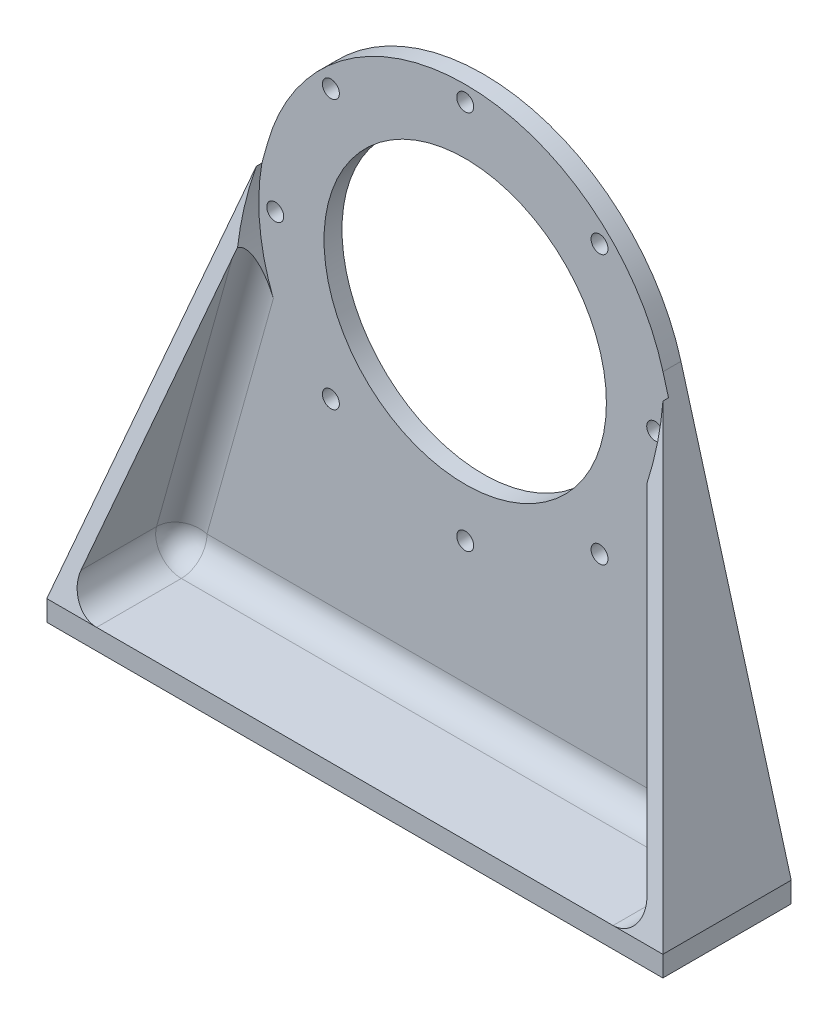
from build123d import *

# Parameters (mm, degrees)
EXTRUDE_3_DEPTH          = 25
SKETCH_1_5_R             = 1.65
SKETCH_1_5_R_2           = 27.5
EXTRUDE_4_DEPTH          = 3.5
CUT_EXTRUDE_1_DEPTH      = 116
CUT_EXTRUDE_1_DEPTH_BACK = 90
SKETCH_3_R               = 40.2
CUT_EXTRUDE_2_DEPTH      = 90
FILLET_1_R               = 5


with BuildPart() as part:
    # 草图1 → 凸台-拉伸3 (new body)
    with BuildSketch(Plane.XY):
        with BuildLine():
            Line((56.884812739, -66), (60, -66))
            Line((60, -66), (38.520958758, 10.776629174))
            ThreePointArc((38.520958758, 10.776629174), (0, 40), (-38.520958758, 10.776629174))
            Line((-38.520958758, 10.776629174), (-60, -66))
            Line((-60, -66), (-56.884812739, -66))
            Line((-56.884812739, -66), (-38.56602674, -0.519673214))
            ThreePointArc((-38.56602674, -0.519673214), (-38.588989549, 0.444535953), (-38.069024769, 1.256855618))
            Line((-38.069024769, 1.256855618), (-35.631886851, 9.968381986))
            ThreePointArc((-35.631886851, 9.968381986), (-32.349305917, 17.958908839), (-27.303372186, 24.970499941))
            ThreePointArc((-27.303372186, 24.970499941), (-27.329677093, 27.329677093), (-24.970499941, 27.303372186))
            ThreePointArc((-24.970499941, 27.303372186), (-14.159286998, 34.183542703), (-1.649589784, 36.963209459))
            ThreePointArc((-1.649589784, 36.963209459), (-0.018396414, 38.649897443), (1.65, 37))
            ThreePointArc((1.65, 37), (1.649897443, 36.981603586), (1.649589784, 36.963209459))
            ThreePointArc((1.649589784, 36.963209459), (14.159286998, 34.183542703), (24.970499941, 27.303372186))
            ThreePointArc((24.970499941, 27.303372186), (26.77734325, 27.694297385), (27.812950904, 26.162950904))
            ThreePointArc((27.812950904, 26.162950904), (27.680217379, 25.514566417), (27.303372186, 24.970499941))
            ThreePointArc((27.303372186, 24.970499941), (32.349305917, 17.958908839), (35.631886851, 9.968381986))
            Line((35.631886851, 9.968381986), (38.069024769, 1.256855618))
            ThreePointArc((38.069024769, 1.256855618), (38.497730094, 0.692318255), (38.65, 0))
            ThreePointArc((38.65, 0), (38.628871407, -0.263207028), (38.56602674, -0.519673214))
            Line((38.56602674, -0.519673214), (56.884812739, -66))
        make_face()
        Polygon((-60, -70), (-60, -66), (60, -66), (60, -70), (0, -70), align=None)
    extrude(amount=EXTRUDE_3_DEPTH)

    # 草图1<5> → 凸台-拉伸4 (add)
    with BuildSketch(Plane.XY):
        with BuildLine():
            Line((-56.884812739, -66), (56.884812739, -66))
            Line((56.884812739, -66), (38.56602674, -0.519673214))
            ThreePointArc((38.56602674, -0.519673214), (35.411010451, -0.444535953), (38.069024769, 1.256855618))
            Line((38.069024769, 1.256855618), (35.631886851, 9.968381986))
            ThreePointArc((35.631886851, 9.968381986), (32.349305917, 17.958908839), (27.303372186, 24.970499941))
            ThreePointArc((27.303372186, 24.970499941), (24.996224715, 24.996224715), (24.970499941, 27.303372186))
            ThreePointArc((24.970499941, 27.303372186), (14.159286998, 34.183542703), (1.649589784, 36.963209459))
            ThreePointArc((1.649589784, 36.963209459), (0, 35.35), (-1.649589784, 36.963209459))
            ThreePointArc((-1.649589784, 36.963209459), (-14.159286998, 34.183542703), (-24.970499941, 27.303372186))
            ThreePointArc((-24.970499941, 27.303372186), (-24.631604423, 26.77734325), (-24.512950904, 26.162950904))
            ThreePointArc((-24.512950904, 26.162950904), (-25.514566417, 24.645684428), (-27.303372186, 24.970499941))
            ThreePointArc((-27.303372186, 24.970499941), (-32.349305917, 17.958908839), (-35.631886851, 9.968381986))
            Line((-35.631886851, 9.968381986), (-38.069024769, 1.256855618))
            ThreePointArc((-38.069024769, 1.256855618), (-36.307681745, 1.497730094), (-35.35, 0))
            ThreePointArc((-35.35, 0), (-36.736792972, -1.628871407), (-38.56602674, -0.519673214))
            Line((-38.56602674, -0.519673214), (-56.884812739, -66))
        make_face()
        with Locations((0, -37)):
            Circle(SKETCH_1_5_R, mode=Mode.SUBTRACT)
        with Locations((-26.162950904, -26.162950904)):
            Circle(SKETCH_1_5_R, mode=Mode.SUBTRACT)
        with Locations((26.162950904, -26.162950904)):
            Circle(SKETCH_1_5_R, mode=Mode.SUBTRACT)
        Circle(SKETCH_1_5_R_2, mode=Mode.SUBTRACT)
    extrude(amount=EXTRUDE_4_DEPTH)

    # 草图2 → 切除-拉伸1 (cut, two sides: drawn at the far end of the back side and taken through both)
    with BuildSketch(Plane(origin=(0, 0, 0), x_dir=(0, 0, -1), z_dir=(1, 0, 0)).offset(-CUT_EXTRUDE_1_DEPTH_BACK)):
        Polygon((-25, -66), (-3.5, 10.776629174), (-3.5, 62.872025622), (-39.293867153, 54.574713181), (-52.271714816, -41.589010491), align=None)
    extrude(amount=CUT_EXTRUDE_1_DEPTH + CUT_EXTRUDE_1_DEPTH_BACK, mode=Mode.SUBTRACT)

    # 草图3 → 切除-拉伸2 (cut)
    with BuildSketch(Plane.XY.offset(3.5)):
        Circle(SKETCH_3_R)
    extrude(amount=CUT_EXTRUDE_2_DEPTH, mode=Mode.SUBTRACT)

    # 圆角1
    # the kernel refuses this fillet: 5 mm, written as the material it adds along each edge
    with BuildSketch(Plane(origin=(-50.294033224, -61, 8.5), x_dir=(0, -1, 0), z_dir=(0, 0, -1))) as fillet_1_piece_1_section:
        Polygon((0, 0), (FILLET_1_R, 0), (FILLET_1_R, FILLET_1_R * 1.31815590294), (-FILLET_1_R * 0.269415729351, FILLET_1_R * 0.963023968953), align=None)
    fillet_1_piece_1 = extrude(amount=FILLET_1_R, mode=Mode.PRIVATE)
    fillet_1_piece_1 = fillet_1_piece_1 - Plane(origin=(-50.294033224, -61, 8.5), x_dir=(0.7966855494331734, 0.6043940232367977, 0), z_dir=(0, 0, -1)) * Sphere(FILLET_1_R, mode=Mode.PRIVATE)
    add(fillet_1_piece_1)
    with BuildSketch(Plane(origin=(50.294033224, -61, 8.5), x_dir=(0.9630239689530686, 0.26941572935127434, 0), z_dir=(0, 0, -1))) as fillet_1_piece_2_section:
        Polygon((0, 0), (FILLET_1_R, 0), (FILLET_1_R, FILLET_1_R * 1.31815590294), (-FILLET_1_R * 0.269415729351, FILLET_1_R * 0.963023968953), align=None)
    fillet_1_piece_2 = extrude(amount=FILLET_1_R, mode=Mode.PRIVATE)
    fillet_1_piece_2 = fillet_1_piece_2 - Plane(origin=(50.294033224, -61, 8.5), x_dir=(-0.7966855494331732, 0.6043940232367977, 0), z_dir=(0, 0, -1)) * Sphere(FILLET_1_R, mode=Mode.PRIVATE)
    add(fillet_1_piece_2)
    with BuildSketch(Plane(origin=(-56.884812739, -66, 8.5), x_dir=(1, 0, 0), z_dir=(0, 0, 1))) as fillet_1_piece_3_section:
        with BuildLine():
            CenterArc((FILLET_1_R * 1.31815590294, FILLET_1_R), FILLET_1_R, 164.370497689, 105.629502311)
            Line((FILLET_1_R * 0.35513193399, FILLET_1_R * 1.26941572935), (0, 0))
            Line((0, 0), (FILLET_1_R * 1.31815590294, 0))
        make_face()
    fillet_1_piece_3 = extrude(amount=16.5, mode=Mode.PRIVATE)
    fillet_1_piece_3 = split(fillet_1_piece_3, bisect_by=Plane(origin=(-54.909873659, -62.45182584, 24.006393674), z_dir=(0, -0.26965951135538185, -0.9629557351901368)), keep=Keep.TOP, mode=Mode.PRIVATE)
    add(fillet_1_piece_3)
    with BuildSketch(Plane(origin=(56.884812739, -66, 8.5), x_dir=(-0.26941572935127367, 0.963023968953069, 0), z_dir=(0, 0, 1))) as fillet_1_piece_4_section:
        with BuildLine():
            CenterArc((FILLET_1_R * 1.31815590294, FILLET_1_R), FILLET_1_R, 164.370497689, 105.629502311)
            Line((FILLET_1_R * 0.35513193399, FILLET_1_R * 1.26941572935), (0, 0))
            Line((0, 0), (FILLET_1_R * 1.31815590294, 0))
        make_face()
    fillet_1_piece_4 = extrude(amount=16.5, mode=Mode.PRIVATE)
    fillet_1_piece_4 = split(fillet_1_piece_4, bisect_by=Plane(origin=(54.909873659, -62.45182584, 24.006393674), z_dir=(0, -0.26965951135538185, -0.9629557351901368)), keep=Keep.TOP, mode=Mode.PRIVATE)
    add(fillet_1_piece_4)
    with BuildSketch(Plane(origin=(-50.294033224, -66, 3.5), x_dir=(0, 1, 0), z_dir=(1, 0, 0))) as fillet_1_piece_5:
        with BuildLine():
            CenterArc((FILLET_1_R, FILLET_1_R), FILLET_1_R, 180, 90)
            Line((0, FILLET_1_R), (0, 0))
            Line((0, 0), (FILLET_1_R, 0))
        make_face()
    extrude(amount=100.588066449)
    with BuildSketch(Plane(origin=(-36.498733621, 6.86984643, 3.5), x_dir=(0.9630239689530686, -0.26941572935127456, 0), z_dir=(-0.26941572935127456, -0.9630239689530686, 0))) as fillet_1_piece_6_section:
        with BuildLine():
            CenterArc((FILLET_1_R, FILLET_1_R), FILLET_1_R, 180, 90)
            Line((0, FILLET_1_R), (0, 0))
            Line((0, 0), (FILLET_1_R, 0))
        make_face()
    fillet_1_piece_6 = extrude(amount=69.076959586, mode=Mode.PRIVATE)
    fillet_1_piece_6 = fillet_1_piece_6 - Plane(origin=(0, 0, 4.655624457), x_dir=(1, 0, 0), z_dir=(0, 0, -1)) * Cylinder(40.2, 159, mode=Mode.PRIVATE)
    fillet_1_piece_6 = split(fillet_1_piece_6, bisect_by=Plane(origin=(-46.735846126, -30.837467909, 15.153325978), z_dir=(0, -0.26965951135538185, -0.9629557351901368)), keep=Keep.TOP, mode=Mode.PRIVATE)
    add(fillet_1_piece_6)
    with BuildSketch(Plane(origin=(55.109153069, -59.652921353, 3.5), x_dir=(-0.9630239689530686, -0.2694157293512744, 0), z_dir=(-0.26941572935127434, 0.9630239689530686, 0))) as fillet_1_piece_7_section:
        with BuildLine():
            CenterArc((FILLET_1_R, FILLET_1_R), FILLET_1_R, 180, 90)
            Line((0, FILLET_1_R), (0, 0))
            Line((0, 0), (FILLET_1_R, 0))
        make_face()
    fillet_1_piece_7 = extrude(amount=69.076959586, mode=Mode.PRIVATE)
    fillet_1_piece_7 = fillet_1_piece_7 - Plane(origin=(0, 0, 4.655620612), x_dir=(1, 0, 0), z_dir=(0, 0, -1)) * Cylinder(40.2, 159, mode=Mode.PRIVATE)
    fillet_1_piece_7 = split(fillet_1_piece_7, bisect_by=Plane(origin=(46.735848084, -30.837472193, 15.153327178), z_dir=(0, -0.26965951135538185, -0.9629557351901368)), keep=Keep.TOP, mode=Mode.PRIVATE)
    add(fillet_1_piece_7)


solid = part.part
